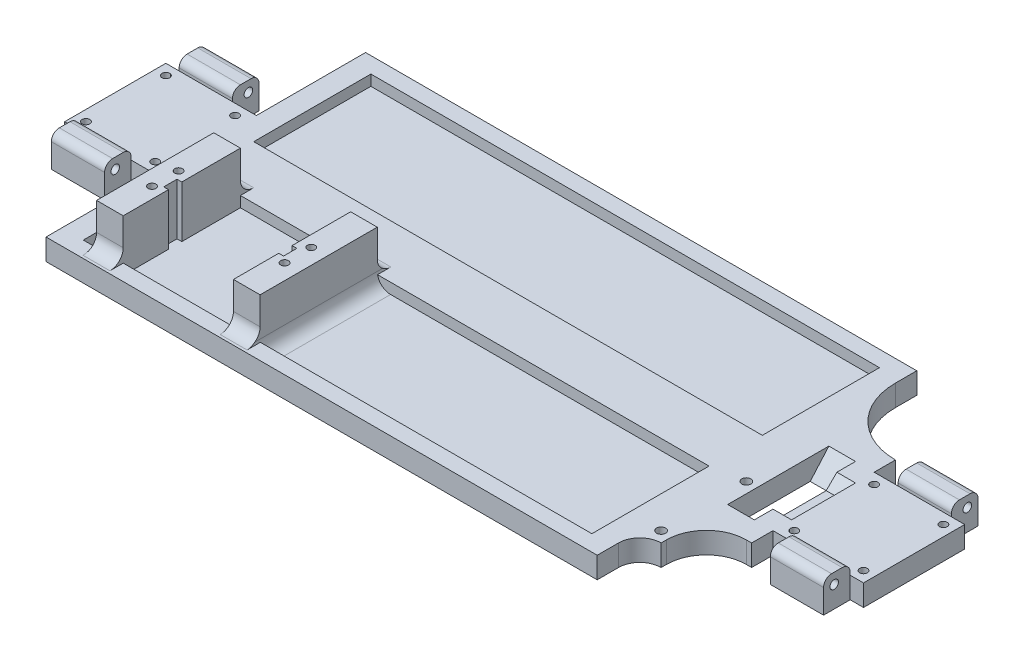
from build123d import *

# Parameters (mm, degrees)
SKETCH1_W            = 300
SKETCH1_H            = 20
BOSS_EXTRUDE1_DEPTH  = 8
SKETCH2_W            = 34
SKETCH2_H            = 8
BOSS_EXTRUDE2_DEPTH  = 9
SKETCH3_W            = 34
SKETCH3_H            = 8
BOSS_EXTRUDE3_DEPTH  = 9
SKETCH4_R            = 1.45
CUT_EXTRUDE1_DEPTH   = 302.504560496
SKETCH5_W            = 25
SKETCH5_H            = 8
BOSS_EXTRUDE4_DEPTH  = 17
SKETCH6_W            = 25
SKETCH6_H            = 8
BOSS_EXTRUDE5_DEPTH  = 17
SKETCH7_W            = 10
SKETCH7_H            = 38
CUT_EXTRUDE2_DEPTH   = 303.37890138
SKETCH8_W            = 7
SKETCH8_H            = 16
CUT_EXTRUDE3_DEPTH   = 4
CUT_EXTRUDE4_DEPTH   = 7
BOSS_EXTRUDE6_DEPTH  = 10
SKETCH12_W           = 8
SKETCH12_H           = 8
BOSS_EXTRUDE7_DEPTH  = 17
SKETCH13_R           = 1.7
CUT_EXTRUDE6_DEPTH   = 305.926220585
SKETCH14_W           = 20
SKETCH14_H           = 12
BOSS_EXTRUDE8_DEPTH  = 10
SKETCH15_R           = 1.6
CUT_EXTRUDE7_DEPTH   = 20
SKETCH16_W           = 20
SKETCH16_H           = 12
BOSS_EXTRUDE9_DEPTH  = 10
SKETCH17_R           = 1.6
CUT_EXTRUDE8_DEPTH   = 20
SKETCH18_W           = 20
SKETCH18_H           = 12
BOSS_EXTRUDE10_DEPTH = 10
CUT_EXTRUDE9_START   = -20
SKETCH19_R           = 1.6
CUT_EXTRUDE9_DEPTH   = 20
SKETCH20_W           = 20
SKETCH20_H           = 12
BOSS_EXTRUDE11_DEPTH = 10
CUT_EXTRUDE10_START  = -20
SKETCH21_R           = 1.6
CUT_EXTRUDE10_DEPTH  = 20
SKETCH22_W           = 207
SKETCH22_H           = 50
BOSS_EXTRUDE12_DEPTH = 8
SKETCH23_W           = 191
SKETCH23_H           = 44
CUT_EXTRUDE11_DEPTH  = 4
SKETCH24_W           = 10
SKETCH24_H           = 44
BOSS_EXTRUDE14_DEPTH = 19.4
SKETCH25_R           = 1.45
CUT_EXTRUDE12_DEPTH  = 15
FILLET1_R            = 5
FILLET2_R            = 5
FILLET3_R            = 8
FILLET4_R            = 15
FILLET5_R            = 25
FILLET6_R            = 3
SKETCH27_W           = 1.8
SKETCH27_H           = 5
CUT_EXTRUDE13_DEPTH  = 19.4


with BuildPart() as part:
    # Sketch1 → Boss-Extrude1 (new body)
    with BuildSketch(Plane(origin=(0, 0, 0), x_dir=(1, 0, 0), z_dir=(0, 1, 0))):
        with Locations((150, -10)):
            Rectangle(SKETCH1_W, SKETCH1_H)
    extrude(amount=BOSS_EXTRUDE1_DEPTH)

    # Sketch2 → Boss-Extrude2 (add)
    with BuildSketch(Plane.XY.offset(20)):
        with Locations((17, 4)):
            Rectangle(SKETCH2_W, SKETCH2_H)
        with Locations((283, 4)):
            Rectangle(SKETCH2_W, SKETCH2_H)
    extrude(amount=BOSS_EXTRUDE2_DEPTH)

    # Sketch3 → Boss-Extrude3 (add)
    with BuildSketch(Plane(origin=(0, 0, 0), x_dir=(-1, 0, 0), z_dir=(0, 0, -1))):
        with Locations((-17, 4)):
            Rectangle(SKETCH3_W, SKETCH3_H)
        with Locations((-283, 4)):
            Rectangle(SKETCH3_W, SKETCH3_H)
    extrude(amount=BOSS_EXTRUDE3_DEPTH)

    # Sketch4 → Cut-Extrude1 (cut, through all)
    with BuildSketch(Plane(origin=(0, 8, 0), x_dir=(1, 0, 0), z_dir=(0, 1, 0))):
        with Locations(Location((4, 5, 0), (0, 0, 270))):
            Circle(SKETCH4_R)
        with Locations(Location((30, 5, 0), (0, 0, 270))):
            Circle(SKETCH4_R)
        with Locations(Location((30, -25, 0), (0, 0, 270))):
            Circle(SKETCH4_R)
        with Locations(Location((4, -25, 0), (0, 0, 270))):
            Circle(SKETCH4_R)
        with Locations(Location((296, -25, 0), (0, 0, 270))):
            Circle(SKETCH4_R)
        with Locations(Location((296, 5, 0), (0, 0, 270))):
            Circle(SKETCH4_R)
        with Locations(Location((270, -25, 0), (0, 0, 270))):
            Circle(SKETCH4_R)
        with Locations(Location((270, 5, 0), (0, 0, 270))):
            Circle(SKETCH4_R)
    extrude(amount=-CUT_EXTRUDE1_DEPTH, mode=Mode.SUBTRACT)

    # Sketch5 → Boss-Extrude4 (add)
    with BuildSketch(Plane.XY.offset(20)):
        with Locations((253.5, 4)):
            Rectangle(SKETCH5_W, SKETCH5_H)
    extrude(amount=BOSS_EXTRUDE4_DEPTH)

    # Sketch6 → Boss-Extrude5 (add)
    with BuildSketch(Plane(origin=(0, 0, 0), x_dir=(-1, 0, 0), z_dir=(0, 0, -1))):
        with Locations((-253.5, 4)):
            Rectangle(SKETCH6_W, SKETCH6_H)
    extrude(amount=BOSS_EXTRUDE5_DEPTH)

    # Sketch7 → Cut-Extrude2 (cut, through all)
    with BuildSketch(Plane(origin=(0, 8, 0), x_dir=(1, 0, 0), z_dir=(0, 1, 0))):
        with Locations((254, -10)):
            Rectangle(SKETCH7_W, SKETCH7_H)
    extrude(amount=-CUT_EXTRUDE2_DEPTH, mode=Mode.SUBTRACT)

    # Sketch8 → Cut-Extrude3 (cut)
    with BuildSketch(Plane(origin=(0, 8, 0), x_dir=(1, 0, 0), z_dir=(0, 1, 0))):
        with Locations((262.5, -10)):
            Rectangle(SKETCH8_W, SKETCH8_H)
    extrude(amount=-CUT_EXTRUDE3_DEPTH, mode=Mode.SUBTRACT)

    # Sketch9 → Cut-Extrude4 (cut)
    with BuildSketch(Plane.ZY.offset(-259)):
        Polygon((18, 4), (22, 8), (18, 8), align=None)
        Polygon((2, 4), (-2, 8), (2, 8), align=None)
    extrude(amount=-CUT_EXTRUDE4_DEPTH, mode=Mode.SUBTRACT)

    # Sketch10 → Boss-Extrude6 (add)
    with BuildSketch(Plane.ZY.offset(-259)):
        Polygon((-2, 0), (-9, 8), (-9, 0), align=None)
        Polygon((29, 8), (22, 0), (29, 0), align=None)
    extrude(amount=BOSS_EXTRUDE6_DEPTH)

    # Sketch12 → Boss-Extrude7 (add)
    with BuildSketch(Plane.XY.offset(37)):
        with Locations((245, 4)):
            Rectangle(SKETCH12_W, SKETCH12_H)
    extrude(amount=BOSS_EXTRUDE7_DEPTH)

    # Sketch13 → Cut-Extrude6 (cut, through all)
    with BuildSketch(Plane(origin=(0, 8, 0), x_dir=(1, 0, 0), z_dir=(0, 1, 0))):
        with Locations(Location((245, -50, 0), (0, 0, 270))):
            Circle(SKETCH13_R)
        with Locations(Location((245, -18, 0), (0, 0, 270))):
            Circle(SKETCH13_R)
    extrude(amount=-CUT_EXTRUDE6_DEPTH, mode=Mode.SUBTRACT)

    # Sketch14 → Boss-Extrude8 (add)
    with BuildSketch(Plane.XY.offset(29)):
        with Locations((285, 6)):
            Rectangle(SKETCH14_W, SKETCH14_H)
    extrude(amount=BOSS_EXTRUDE8_DEPTH)

    # Sketch15 → Cut-Extrude7 (cut)
    with BuildSketch(Plane(origin=(295, 0, 0), x_dir=(0, 0, -1), z_dir=(1, 0, 0))):
        with Locations((-35, 8)):
            Circle(SKETCH15_R)
    extrude(amount=-CUT_EXTRUDE7_DEPTH, mode=Mode.SUBTRACT)

    # Sketch16 → Boss-Extrude9 (add)
    with BuildSketch(Plane(origin=(0, 0, -9), x_dir=(-1, 0, 0), z_dir=(0, 0, -1))):
        with Locations((-285, 6)):
            Rectangle(SKETCH16_W, SKETCH16_H)
    extrude(amount=BOSS_EXTRUDE9_DEPTH)

    # Sketch17 → Cut-Extrude8 (cut)
    with BuildSketch(Plane(origin=(295, 0, 0), x_dir=(0, 0, -1), z_dir=(1, 0, 0))):
        with Locations((15, 8)):
            Circle(SKETCH17_R)
    extrude(amount=-CUT_EXTRUDE8_DEPTH, mode=Mode.SUBTRACT)

    # Sketch18 → Boss-Extrude10 (add)
    with BuildSketch(Plane(origin=(0, 0, -9), x_dir=(-1, 0, 0), z_dir=(0, 0, -1))):
        with Locations((-15, 6)):
            Rectangle(SKETCH18_W, SKETCH18_H)
    extrude(amount=BOSS_EXTRUDE10_DEPTH)

    # Sketch19 → Cut-Extrude9 (cut)
    with BuildSketch(Plane.ZY.offset(-5).offset(CUT_EXTRUDE9_START)):
        with Locations(Location((-15, 8, 0), (0, 0, 180))):
            Circle(SKETCH19_R)
    extrude(amount=CUT_EXTRUDE9_DEPTH, mode=Mode.SUBTRACT)

    # Sketch20 → Boss-Extrude11 (add)
    with BuildSketch(Plane.XY.offset(29)):
        with Locations((15, 6)):
            Rectangle(SKETCH20_W, SKETCH20_H)
    extrude(amount=BOSS_EXTRUDE11_DEPTH)

    # Sketch21 → Cut-Extrude10 (cut)
    with BuildSketch(Plane.ZY.offset(-5).offset(CUT_EXTRUDE10_START)):
        with Locations(Location((35, 8, 0), (0, 0, 180))):
            Circle(SKETCH21_R)
    extrude(amount=CUT_EXTRUDE10_DEPTH, mode=Mode.SUBTRACT)

    # Sketch22 → Boss-Extrude12 (add)
    with BuildSketch(Plane(origin=(0, 0, 0), x_dir=(-1, 0, 0), z_dir=(0, -1, 0))):
        with Locations((-137.5, -45)):
            Rectangle(SKETCH22_W, SKETCH22_H)
        with Locations((-137.5, 25)):
            Rectangle(SKETCH22_W, SKETCH22_H)
    extrude(amount=-BOSS_EXTRUDE12_DEPTH)

    # Sketch23 → Cut-Extrude11 (cut)
    with BuildSketch(Plane(origin=(0, 8, 0), x_dir=(1, 0, 0), z_dir=(0, 1, 0))):
        with Locations((137.5, -42)):
            Rectangle(SKETCH23_W, SKETCH23_H)
        with Locations((137.5, 22)):
            Rectangle(SKETCH23_W, SKETCH23_H)
    extrude(amount=-CUT_EXTRUDE11_DEPTH, mode=Mode.SUBTRACT)

    # Sketch24 → Boss-Extrude14 (add)
    with BuildSketch(Plane(origin=(0, 4, 0), x_dir=(1, 0, 0), z_dir=(0, 1, 0))):
        with Locations((103.4, -42)):
            Rectangle(SKETCH24_W, SKETCH24_H)
        with Locations((52, -42)):
            Rectangle(SKETCH24_W, SKETCH24_H)
    extrude(amount=BOSS_EXTRUDE14_DEPTH)

    # Sketch25 → Cut-Extrude12 (cut)
    with BuildSketch(Plane(origin=(0, 23.4, 0), x_dir=(1, 0, 0), z_dir=(0, 1, 0))):
        with Locations(Location((102.6, -49, 0), (0, 0, 270))):
            Circle(SKETCH25_R)
        with Locations(Location((102.6, -39, 0), (0, 0, 270))):
            Circle(SKETCH25_R)
        with Locations(Location((52.8, -49, 0), (0, 0, 270))):
            Circle(SKETCH25_R)
        with Locations(Location((52.8, -39, 0), (0, 0, 270))):
            Circle(SKETCH25_R)
    extrude(amount=-CUT_EXTRUDE12_DEPTH, mode=Mode.SUBTRACT)

    # Fillet1
    fillet1_edges = [part.edges().sort_by_distance(p)[0] for p in [
        (103.4, 8, 64),
        (103.4, 8, 20),
        (52, 8, 64),
        (52, 8, 20),
    ]]
    fillet(fillet1_edges, radius=FILLET1_R)

    # Fillet2
    fillet2_edges = [part.edges().sort_by_distance(p)[0] for p in [
        (47, 4, 42),
        (108.4, 4, 42),
    ]]
    fillet(fillet2_edges, radius=FILLET2_R - 0.0001)  # a hair under: the kernel refuses the full size

    # Fillet3
    fillet3_edges = [part.edges().sort_by_distance(p)[0] for p in [
        (241, 4, 54),
    ]]
    fillet(fillet3_edges, radius=FILLET3_R - 0.0001)  # a hair under: the kernel refuses the full size

    # Fillet4
    fillet4_edges = [part.edges().sort_by_distance(p)[0] for p in [
        (249, 4, 37),
    ]]
    fillet(fillet4_edges, radius=FILLET4_R)

    # Fillet5
    fillet5_edges = [part.edges().sort_by_distance(p)[0] for p in [
        (241, 4, -17),
    ]]
    fillet(fillet5_edges, radius=FILLET5_R - 0.0001)  # a hair under: the kernel refuses the full size

    # Fillet6
    fillet6_edges = [part.edges().sort_by_distance(p)[0] for p in [
        (285, 12, 29),
        (285, 12, 39),
        (285, 12, -9),
        (285, 12, -19),
        (15, 12, -9),
        (15, 12, -19),
        (15, 12, 29),
        (15, 12, 39),
    ]]
    fillet(fillet6_edges, radius=FILLET6_R)

    # Sketch27 → Cut-Extrude13 (cut)
    with BuildSketch(Plane(origin=(0, 23.4, 0), x_dir=(1, 0, 0), z_dir=(0, 1, 0))):
        with Locations((56.1, -44.5)):
            Rectangle(SKETCH27_W, SKETCH27_H)
        with Locations((99.3, -44.5)):
            Rectangle(SKETCH27_W, SKETCH27_H)
    extrude(amount=-CUT_EXTRUDE13_DEPTH, mode=Mode.SUBTRACT)


solid = part.part
